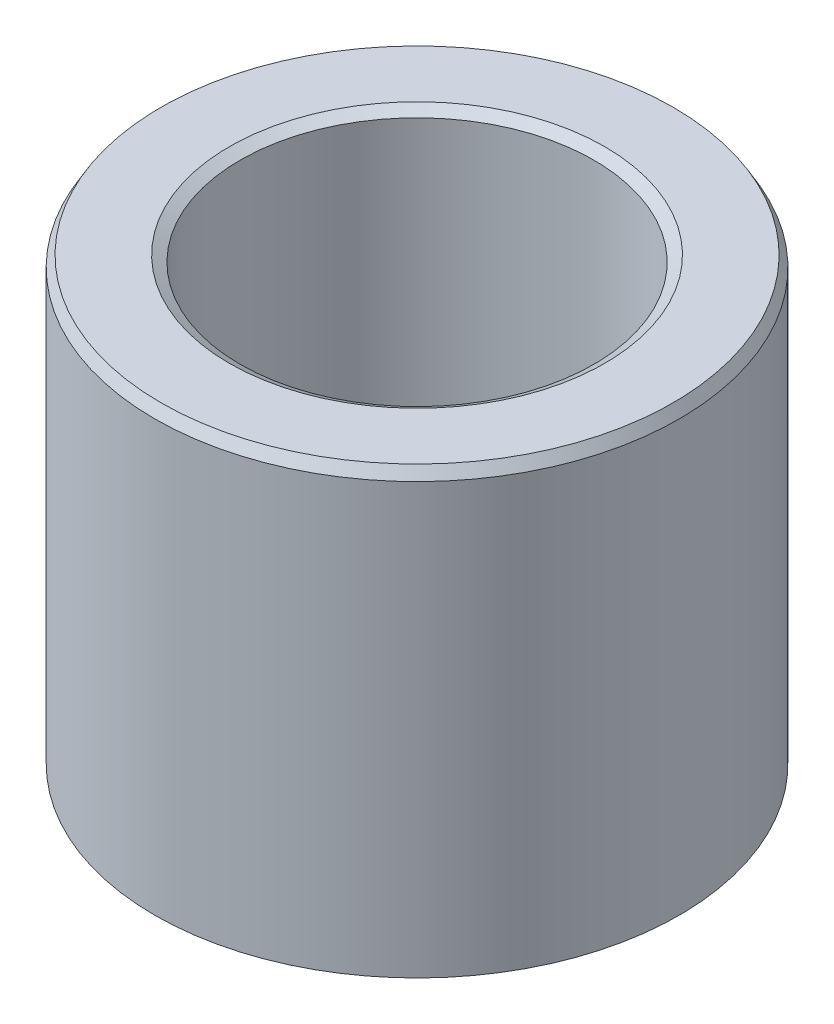
from build123d import *
from OCP.BRepFilletAPI import BRepFilletAPI_MakeChamfer

# Parameters (mm, degrees)
SKETCH1_R           = 47.5
BOSS_EXTRUDE1_DEPTH = 80.945140717
SKETCH2_R           = 32.036402396
CUT_EXTRUDE1_DEPTH  = 106.188477533
CHAMFER1_SIZE       = 1.958223642
CHAMFER1_SIZE2      = 1.130580947


with BuildPart() as part:
    # Sketch1 → Boss-Extrude1 (new body)
    with BuildSketch(Plane(origin=(0, 0, 0), x_dir=(1, 0, 0), z_dir=(0, 1, 0))):
        Circle(SKETCH1_R)
    extrude(amount=BOSS_EXTRUDE1_DEPTH)

    # Sketch2 → Cut-Extrude1 (cut, through all)
    with BuildSketch(Plane(origin=(0, 0, 0), x_dir=(1, 0, 0), z_dir=(0, 1, 0))):
        Circle(SKETCH2_R)
    extrude(amount=CUT_EXTRUDE1_DEPTH, mode=Mode.SUBTRACT)

    # Chamfer1: one chamfer whose edges measure the first distance from different faces: ONE call of the kernel's chamfer builder (chamfer() names one face for all edges)
    chamfer1_edges_1 = [part.edges().sort_by_distance(p)[0] for p in [
        (-32.036402396, 80.945140717, 0),
    ]]
    chamfer1_side_1 = [part.faces().sort_by_distance(p)[0] for p in [
        (-46.156497116, 80.945140717, 0),
    ]]
    chamfer1_edges_2 = [part.edges().sort_by_distance(p)[0] for p in [
        (-32.036402396, 0, 0),
    ]]
    chamfer1_side_2 = [part.faces().sort_by_distance(p)[0] for p in [
        (-32.036402396, 40.472570359, 0),
    ]]
    chamfer1_edges_3 = [part.edges().sort_by_distance(p)[0] for p in [
        (-47.5, 0, 0),
    ]]
    chamfer1_side_3 = [part.faces().sort_by_distance(p)[0] for p in [
        (-46.156497116, 0, 0),
    ]]
    chamfer1_edges_4 = [part.edges().sort_by_distance(p)[0] for p in [
        (-47.5, 80.945140717, 0),
    ]]
    chamfer1_side_4 = [part.faces().sort_by_distance(p)[0] for p in [
        (-47.5, 40.472570359, 0),
    ]]
    chamfer1 = BRepFilletAPI_MakeChamfer(part.part.solid().wrapped)
    for e in chamfer1_edges_1:
        chamfer1.Add(CHAMFER1_SIZE, CHAMFER1_SIZE2, e.wrapped, chamfer1_side_1[0].wrapped)  # the first distance lies on this face
    for e in chamfer1_edges_2:
        chamfer1.Add(CHAMFER1_SIZE, CHAMFER1_SIZE2, e.wrapped, chamfer1_side_2[0].wrapped)  # the first distance lies on this face
    for e in chamfer1_edges_3:
        chamfer1.Add(CHAMFER1_SIZE, CHAMFER1_SIZE2, e.wrapped, chamfer1_side_3[0].wrapped)  # the first distance lies on this face
    for e in chamfer1_edges_4:
        chamfer1.Add(CHAMFER1_SIZE, CHAMFER1_SIZE2, e.wrapped, chamfer1_side_4[0].wrapped)  # the first distance lies on this face
    add(Compound.cast(chamfer1.Shape()), mode=Mode.REPLACE)


solid = part.part
